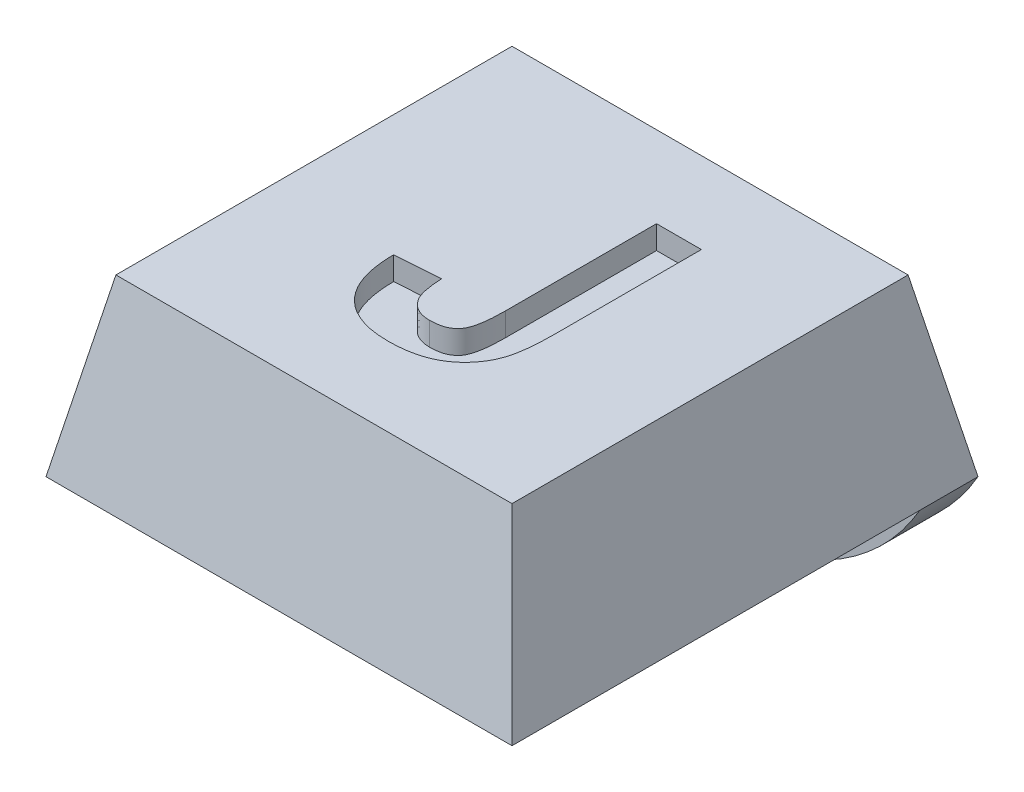
from build123d import *

# Parameters (mm, degrees)
SKETCH1_W               = 8
SKETCH1_H               = 8
BOSS_EXTRUDE1_DEPTH     = 3
CUT_EXTRUDE1_DEPTH      = 12.704699911
CUT_EXTRUDE1_DEPTH_BACK = 12.704699911
CUT_EXTRUDE2_DEPTH      = 11
SKETCH4_R               = 1.8
CUT_EXTRUDE3_DEPTH      = 0.8
SKETCH5_W               = 8
SKETCH5_H               = 1
BOSS_EXTRUDE2_DEPTH     = 2
FILLET1_R               = 4
CUT_EXTRUDE4_DEPTH      = 0.4


with BuildPart() as part:
    # Sketch1 → Boss-Extrude1 (new body)
    with BuildSketch(Plane(origin=(0, 0, 0), x_dir=(1, 0, 0), z_dir=(0, 1, 0))):
        with Locations((4, 4)):
            Rectangle(SKETCH1_W, SKETCH1_H)
    extrude(amount=BOSS_EXTRUDE1_DEPTH)

    # Sketch2 → Cut-Extrude1 (cut, two sides: drawn at the far end of the back side and taken through both)
    with BuildSketch(Plane.XY.offset(-CUT_EXTRUDE1_DEPTH_BACK)):
        Polygon((0, 0), (0.6, 3), (0, 3), align=None)
        Polygon((8, 0), (7.4, 3), (8, 3), align=None)
    extrude(amount=CUT_EXTRUDE1_DEPTH + CUT_EXTRUDE1_DEPTH_BACK, mode=Mode.SUBTRACT)

    # Sketch3 → Cut-Extrude2 (cut)
    with BuildSketch(Plane(origin=(0, 0, 0), x_dir=(0, 0, -1), z_dir=(1, 0, 0))):
        Polygon((0, 0), (0.6, 3), (0, 3), align=None)
        Polygon((8, 3), (7.4, 3), (8, 0), align=None)
    extrude(amount=CUT_EXTRUDE2_DEPTH, mode=Mode.SUBTRACT)

    # Sketch4 → Cut-Extrude3 (cut)
    with BuildSketch(Plane.XZ):
        with Locations(Location((4, -3.75, 0), (0, 0, 270))):
            Circle(SKETCH4_R)
    extrude(amount=-CUT_EXTRUDE3_DEPTH, mode=Mode.SUBTRACT)

    # Sketch5 → Boss-Extrude2 (add)
    with BuildSketch(Plane.XZ):
        with Locations((4, -7.5)):
            Rectangle(SKETCH5_W, SKETCH5_H)
    extrude(amount=BOSS_EXTRUDE2_DEPTH)

    # Fillet1
    # the kernel refuses this fillet: 4 mm, written as the material it takes off along each edge
    with BuildSketch(Plane(origin=(8, -2, -16.660254038), x_dir=(0, 1, 0), z_dir=(0, 0, 1)), Plane(origin=(0, -2, 1.660254038), x_dir=(0, 1, 0), z_dir=(0, 0, -1))) as fillet1_piece_1:
        with BuildLine():
            CenterArc((4, 3.464101615), FILLET1_R, 180, 60)
            Line((0, 3.464101615), (-0.08, 3.464101615))
            Line((-0.08, 3.464101615), (-0.08, 0))
            Line((-0.08, 0), (0, -0.08))
            ThreePointArc((0, -0.08), (1, -0.08), (1.96, -0.069282032))
            Line((1.96, -0.069282032), (2, 0))
        make_face()
    extrude(amount=18.320508076, mode=Mode.SUBTRACT)

    # Sketch6 → Cut-Extrude4 (cut)
    with BuildSketch(Plane(origin=(0, 3, 0), x_dir=(1, 0, 0), z_dir=(0, 1, 0))):
        with BuildLine():
            Line((4.478635236, 6.002856352), (5.247866005, 6.002856352))
            Line((5.247866005, 6.002856352), (5.247866005, 3.481221736))
            add(Edge.make_bspline(
                [(5.247866005, 3.481221736), (5.247522255, 3.441153869), (5.246855206, 3.363401883), (5.242756502, 3.250390465), (5.236658321, 3.14454193), (5.227277222, 3.045871471), (5.21405872, 2.954592388), (5.200049867, 2.869976575), (5.183041427, 2.792451692), (5.167800036, 2.743951306), (5.160526262, 2.72080507)],
                knots=[0, 0, 0, 0, 1.251619961, 2.428777588, 3.532126049, 4.56323557, 5.523704531, 6.412540087, 7.242403515, 8, 8, 8, 8], degree=3))
            add(Edge.make_bspline(
                [(5.160526262, 2.72080507), (5.150361081, 2.692282601), (5.130243602, 2.635834988), (5.091141653, 2.555314881), (5.046176431, 2.479084315), (4.995474484, 2.406812938), (4.939514717, 2.338210987), (4.876399077, 2.275086649), (4.8083478, 2.215238098), (4.733446681, 2.161145289), (4.653580791, 2.110709794), (4.566475051, 2.068688963), (4.473843299, 2.032340387), (4.374908104, 2.002816628), (4.269640778, 1.979716073), (4.158311001, 1.962901894), (4.040770466, 1.95334773), (3.960490164, 1.952175274), (3.919340364, 1.9515743)],
                knots=[0, 0, 0, 0, 0.925533072, 1.831683394, 2.73255258, 3.630007683, 4.529542467, 5.436465751, 6.357118906, 7.298274949, 8.259461937, 9.242242071, 10.251058183, 11.300341426, 12.396409345, 13.544807631, 14.74152597, 16, 16, 16, 16], degree=3))
            add(Edge.make_bspline(
                [(3.919340364, 1.9515743), (3.871225528, 1.952737211), (3.777685944, 1.954998015), (3.641661475, 1.97000769), (3.514100564, 1.996260242), (3.395387048, 2.034179675), (3.284307874, 2.08131717), (3.182206561, 2.140114726), (3.088540477, 2.209392701), (3.003918711, 2.289363431), (2.928299433, 2.379218215), (2.863026475, 2.479745415), (2.80762712, 2.589893743), (2.762984692, 2.710161506), (2.727739397, 2.839972913), (2.702317462, 2.979601288), (2.687147894, 3.129126134), (2.684913172, 3.2319872), (2.683763441, 3.284907634)],
                knots=[0, 0, 0, 0, 1.114068574, 2.165849827, 3.164101702, 4.124467949, 5.046988974, 5.952942428, 6.846011651, 7.738523925, 8.642829306, 9.558838605, 10.50752403, 11.491963144, 12.524197802, 13.618364352, 14.774685164, 16, 16, 16, 16], degree=3))
            Line((2.683763441, 3.284907634), (3.45299421, 3.336189685))
            add(Edge.make_bspline(
                [(3.45299421, 3.336189685), (3.454375767, 3.307862598), (3.45702498, 3.25354382), (3.464380935, 3.175240866), (3.473682687, 3.103271277), (3.485853837, 3.037851064), (3.498960823, 2.978427444), (3.515987002, 2.926169857), (3.533886556, 2.879240769), (3.549608387, 2.851783511), (3.557160877, 2.838593531)],
                knots=[0, 0, 0, 0, 1.326609226, 2.543847584, 3.678365909, 4.719972403, 5.656527627, 6.521948534, 7.28997025, 8, 8, 8, 8], degree=3))
            add(Edge.make_bspline(
                [(3.557160877, 2.838593531), (3.56872297, 2.821148121), (3.59147861, 2.786813382), (3.632990929, 2.742071605), (3.677558537, 2.702955843), (3.727619554, 2.672203009), (3.781780527, 2.648016829), (3.840448037, 2.63044225), (3.903460331, 2.619785853), (3.946808463, 2.61876437), (3.969019851, 2.618240967)],
                knots=[0, 0, 0, 0, 1.023658308, 2.014687051, 2.979722519, 3.920049697, 4.880550909, 5.878122304, 6.912759386, 8, 8, 8, 8], degree=3))
            add(Edge.make_bspline(
                [(3.969019851, 2.618240967), (3.991477248, 2.618659453), (4.034647527, 2.619463917), (4.09686091, 2.626779219), (4.154063033, 2.638632824), (4.206285054, 2.655294856), (4.253703868, 2.676924623), (4.295268393, 2.704596166), (4.33276969, 2.735732915), (4.36516489, 2.773188264), (4.392766236, 2.818318957), (4.415812105, 2.873248962), (4.43563784, 2.938204221), (4.450960178, 3.01367855), (4.464002509, 3.098949399), (4.472183692, 3.194770716), (4.478064386, 3.300859295), (4.478439634, 3.37517575), (4.478635236, 3.413914044)],
                knots=[0, 0, 0, 0, 0.980314827, 1.884477813, 2.730827652, 3.527503874, 4.27366112, 4.998269146, 5.70163477, 6.396145331, 7.150281155, 8.001758491, 8.990432449, 10.111292654, 11.361572691, 12.75538406, 14.308707205, 16, 16, 16, 16], degree=3))
            Line((4.478635236, 3.413914044), (4.478635236, 6.002856352))
        make_face()
    extrude(amount=-CUT_EXTRUDE4_DEPTH, mode=Mode.SUBTRACT)


solid = part.part
